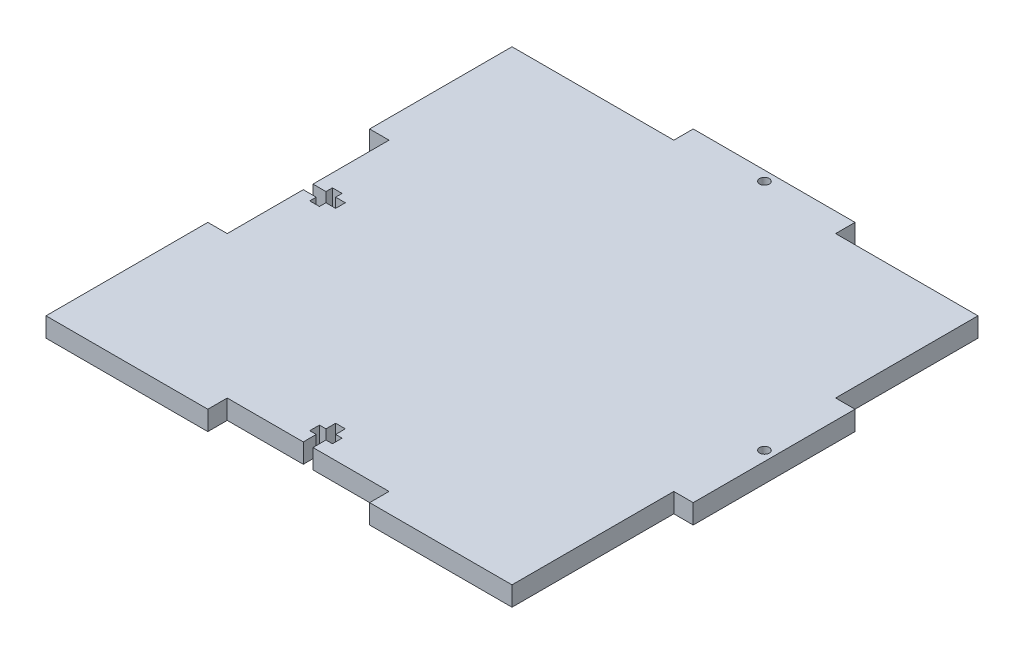
from build123d import *

# Parameters (mm, degrees)
SKETCH1_R           = 1.5
BOSS_EXTRUDE1_DEPTH = 6


with BuildPart() as part:
    # Sketch1 → Boss-Extrude1 (new body)
    with BuildSketch(Plane(origin=(0, 0, 0), x_dir=(1, 0, 0), z_dir=(0, 1, 0))):
        Polygon((-72, 72), (-72, 28), (-66, 28), (-66, 4.5), (-62, 4.5), (-62, 6.5), (-59, 6.5), (-59, 4.5), (-56, 4.5), (-56, 1.5), (-59, 1.5), (-59, -0.5), (-62, -0.5), (-62, 1.5), (-66, 1.5), (-66, -22), (-72, -22), (-72, -72), (-22, -72), (-22, -66), (1.5, -66), (1.5, -62), (-0.5, -62), (-0.5, -59), (1.5, -59), (1.5, -56), (4.5, -56), (4.5, -59), (6.5, -59), (6.5, -62), (4.5, -62), (4.5, -66), (28, -66), (28, -72), (72, -72), (72, -22), (78, -22), (78, 28), (72, 28), (72, 72), (28, 72), (28, 78), (-22, 78), (-22, 72), align=None)
        with Locations((3, 75)):
            Circle(SKETCH1_R, mode=Mode.SUBTRACT)
        with Locations((75, 3)):
            Circle(SKETCH1_R, mode=Mode.SUBTRACT)
    extrude(amount=BOSS_EXTRUDE1_DEPTH)


solid = part.part
